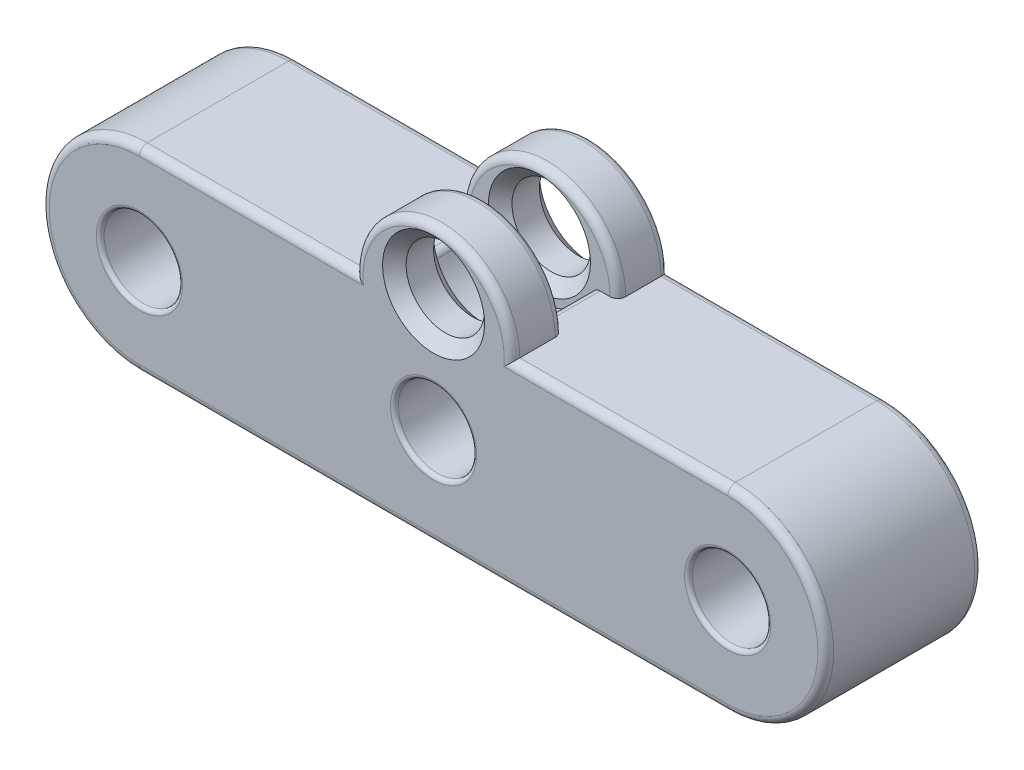
from build123d import *

# Parameters (mm, degrees)
ESQUISSE1_R             = 25
ESQUISSE1_R_2           = 10
ESQUISSE1_R_3           = 25.000000000000004
ESQUISSE1_R_4           = 10.000000000000009
BOSS_EXTRU_1_DEPTH      = 40
BOSS_EXTRU_6_DEPTH      = 13
BOSS_EXTRU_7_START      = -13
BOSS_EXTRU_7_DEPTH      = 13
ENL_V_START             = -40
ENL_V_MAT_EXTRU_3_DEPTH = 40
ESQUISSE16_R            = 14.999999999999998
ENL_V_MAT_EXTRU_8_DEPTH = 14
CONG_4_R                = 2
CONG_7_R                = 1
CHANFREIN2_SIZE         = 3


with BuildPart() as part:
    # Esquisse1 → Boss.-Extru.1 (new body)
    # profile 1 of 4: a face of its own
    with BuildSketch(Plane.XY):
        with Locations((-17.955149191533145, 0.1920124875943955)):
            Circle(ESQUISSE1_R)
        with Locations((-17.955149191533145, 0.1920124875943955)):
            Circle(ESQUISSE1_R_2, mode=Mode.SUBTRACT)
    # profile 2 of 4: a face of its own
    with BuildSketch(Plane.XY):
        with BuildLine():
            Line((57.044850808466855, 10.192012487594386), (57.044850808466855, 25.192012487594397))
            Line((57.044850808466855, 25.192012487594397), (-17.95514919153466, 25.192012487594397))
            ThreePointArc((-17.95514919153466, 25.192012487594397), (-0.27747966186999307, 17.86968201725862), (7.044850808466855, 0.1920124875943955))
            ThreePointArc((7.044850808466855, 0.19201248759438935), (-0.27747966186997886, -17.485657042069814), (-17.955149191534638, -24.807987512405603))
            Line((-17.955149191534638, -24.807987512405607), (57.044850808466855, -24.807987512405607))
            Line((57.044850808466855, -24.807987512405603), (57.044850808466855, -9.807987512405603))
            ThreePointArc((57.0448508084668, -9.8079875124056), (47.04485080846686, 0.192012487594395), (57.044850808466805, 10.192012487594386))
        make_face()
    # profile 3 of 4: a face of its own
    with BuildSketch(Plane.XY):
        with BuildLine():
            Line((132.04485080846524, 25.192012487594397), (57.044850808466855, 25.192012487594397))
            Line((57.044850808466855, 25.192012487594397), (57.044850808466855, 10.192012487594386))
            ThreePointArc((57.044850808466805, 10.192012487594386), (64.11591862033231, 7.263080299459882), (67.04485080846685, 0.19201248759439377))
            ThreePointArc((67.04485080846685, 0.19201248759439132), (64.11591862033231, -6.879055324271097), (57.0448508084668, -9.8079875124056))
            Line((57.044850808466855, -9.807987512405603), (57.044850808466855, -24.807987512405603))
            Line((57.044850808466855, -24.807987512405607), (132.04485080846544, -24.807987512405607))
            ThreePointArc((132.04485080846544, -24.807987512405607), (107.04485080846686, 0.19201248759430972), (132.04485080846524, 25.1920124875944))
        make_face()
    # profile 4 of 4: a face of its own
    with BuildSketch(Plane.XY):
        with Locations((132.04485080846686, 0.1920124875943955)):
            Circle(ESQUISSE1_R_3)
        with Locations((132.04485080846686, 0.1920124875943955)):
            Circle(ESQUISSE1_R_4, mode=Mode.SUBTRACT)
    extrude(amount=BOSS_EXTRU_1_DEPTH)

    # Esquisse2 → Boss.-Extru.6 (add)
    with BuildSketch(Plane(origin=(0, 0, 0), x_dir=(-1, 0, 0), z_dir=(0, 0, -1))):
        with BuildLine():
            Line((-77.04485080846686, 25.192012487594397), (-65.7051048463114, 25.192012487594397))
            ThreePointArc((-65.70510484631134, 25.192012487594546), (-59.63304125949198, 39.8512707504851), (-47.04485080846686, 30.192012487594393))
            ThreePointArc((-47.04485080846686, 30.19201248759439), (-47.38559254557614, 27.603822036569323), (-48.38459677062232, 25.19201248759465))
            Line((-48.38459677062223, 25.192012487594397), (-37.04485080846687, 25.192012487594397))
            ThreePointArc((-37.04485080846687, 25.192012487594397), (-57.04485080846686, 45.19201248759439), (-77.04485080846686, 25.1920124875944))
        make_face()
    extrude(amount=-BOSS_EXTRU_6_DEPTH)

    # Esquisse12 → Boss.-Extru.7 (add)
    with BuildSketch(Plane.XY.offset(40).offset(BOSS_EXTRU_7_START)):
        with BuildLine():
            ThreePointArc((48.384596770622466, 25.192012487594397), (48.38459677062255, 35.192012487594525), (57.04485080846716, 40.1920124875944))
            Line((57.04485080846686, 40.1920124875944), (57.04485080846686, 45.19201248759438))
            ThreePointArc((57.04485080846686, 45.19201248759439), (42.90271518473592, 39.33414811132534), (37.04485080846687, 25.1920124875944))
            Line((37.04485080846687, 25.192012487594397), (48.38459677062247, 25.192012487594397))
        make_face()
        with BuildLine():
            Line((57.04485080846686, 45.19201248759438), (57.04485080846686, 40.1920124875944))
            ThreePointArc((57.04485080846716, 40.1920124875944), (64.11591862033245, 37.263080299459766), (67.04485080846686, 30.192012487594393))
            ThreePointArc((67.04485080846686, 30.19201248759439), (66.70410907135755, 27.603822036569184), (65.70510484631126, 25.192012487594397))
            Line((65.70510484631126, 25.192012487594397), (77.04485080846686, 25.192012487594397))
            ThreePointArc((77.04485080846686, 25.192012487594397), (71.18698643219781, 39.33414811132534), (57.04485080846686, 45.19201248759439))
        make_face()
    extrude(amount=BOSS_EXTRU_7_DEPTH)

    # Esquisse14 → Enlèv. mat.-Extru.3 (cut)
    with BuildSketch(Plane.XY.offset(40).offset(ENL_V_START)):
        with BuildLine():
            Line((65.70510484631126, 25.192012487594397), (57.04485080846686, 25.192012487594397))
            Line((57.04485080846686, 25.192012487594397), (48.38459677062247, 25.192012487594397))
            ThreePointArc((48.38459677062246, 25.192012487594386), (57.04485080846686, 20.192012487594354), (65.70510484631127, 25.19201248759439))
        make_face()
    extrude(amount=ENL_V_MAT_EXTRU_3_DEPTH, mode=Mode.SUBTRACT)

    # Esquisse16 → Enlèv. mat.-Extru.8 (cut)
    with BuildSketch(Plane(origin=(0, 0, 27.000000000000004), x_dir=(-1, 0, 0), z_dir=(0, 0, -1))):
        with Locations((-57.04485080846686, 30.192012487594393)):
            Circle(ESQUISSE16_R)
    extrude(amount=ENL_V_MAT_EXTRU_8_DEPTH, mode=Mode.SUBTRACT)

    # Congé4
    cong_4_edges = [part.edges().sort_by_distance(p)[0] for p in [
        (-42.955149191533145, 0.19201248759437634, 0),
        (9.544850808466101, 25.192012487594397, 0),
        (157.04485080846686, 0.19201248759449943, 0),
        (57.0448508084654, -24.807987512405603, 0),
        (157.04485080846686, 0.1920124875944905, 40),
        (9.544850808466109, 25.192012487594397, 40),
        (-42.955149191533145, 0.19201248759437634, 40),
        (104.54485080846605, 25.192012487594397, 0),
        (57.04485080846686, 45.19201248759438, 13),
        (57.04485080846686, 45.19201248759438, 0),
        (104.54485080846605, 25.192012487594397, 40),
        (57.04485080846686, 45.1920124875944, 27),
        (57.04485080846686, 45.19201248759439, 40),
        (57.0448508084654, -24.807987512405603, 40),
        (42.90271518473591, 25.192012487594397, 20),
        (71.18698643219781, 25.192012487594397, 20),
    ]]
    fillet(cong_4_edges, radius=CONG_4_R)

    # Congé7
    cong_7_edges = [part.edges().sort_by_distance(p)[0] for p in [
        (-27.955149191533145, 0.1920124875943967, 0),
        (57.0448508084669, 10.192012487594384, 0),
        (57.04485080846691, 10.192012487594384, 40),
        (-27.955149191533145, 0.1920124875943967, 40),
        (122.04485080846685, 0.1920124875943967, 40),
        (122.04485080846685, 0.1920124875943967, 0),
    ]]
    fillet(cong_7_edges, radius=CONG_7_R)

    # Chanfrein2
    chanfrein2_edges = [part.edges().sort_by_distance(p)[0] for p in [
        (67.04485080846675, 30.192012487594347, 0),
        (67.04485080846675, 30.192012487594347, 13),
        (65.70510484631126, 35.19201248759437, 40),
        (65.70510484631127, 35.19201248759438, 27),
    ]]
    chamfer(chanfrein2_edges, length=CHANFREIN2_SIZE - 0.0001)  # a hair under: the kernel refuses the full size


solid = part.part
